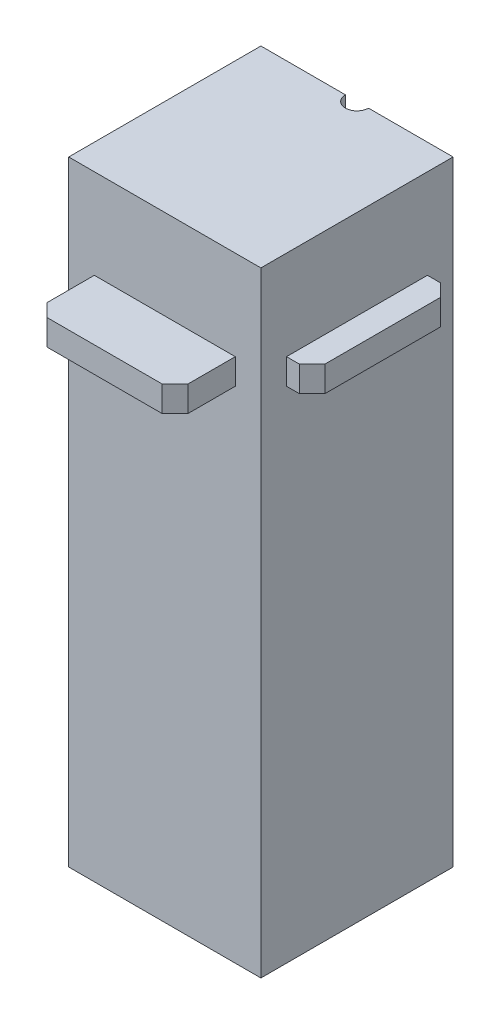
from build123d import *

# Parameters (mm, degrees)
SKETCH2_W            = 150
SKETCH2_H            = 150
SKETCH2_W_2          = 130
SKETCH2_H_2          = 130
BOSS_EXTRUDE2_DEPTH  = 450
SKETCH4_W            = 150
SKETCH4_H            = 150
BOSS_EXTRUDE3_DEPTH  = 15
BOSS_EXTRUDE4_START  = -450
SKETCH4_2_W          = 150
SKETCH4_2_H          = 150
BOSS_EXTRUDE4_DEPTH  = 15
SKETCH5_R            = 30
CUT_EXTRUDE1_DEPTH   = 15
SKETCH7_W            = 20
SKETCH7_H            = 10
BOSS_EXTRUDE5_DEPTH  = 50
BOSS_EXTRUDE6_START  = -10
SKETCH9_R            = 25
BOSS_EXTRUDE6_DEPTH  = 20
CUT_EXTRUDE3_START   = 5
SKETCH10_R           = 25
SKETCH10_R_2         = 22
CUT_EXTRUDE3_DEPTH   = 10
SKETCH12_W           = 20
SKETCH12_H           = 40
BOSS_EXTRUDE7_DEPTH  = 25
SKETCH13_R           = 4
BOSS_EXTRUDE8_DEPTH  = 23
SKETCH14_R           = 9
CUT_EXTRUDE5_DEPTH   = 500
BOSS_EXTRUDE10_START = -150
BOSS_EXTRUDE10_DEPTH = 200
SKETCH18_W           = 110
SKETCH18_H           = 20
BOSS_EXTRUDE11_DEPTH = 20
CHAMFER1_SIZE        = 10
CHAMFER2_SIZE        = 10
SKETCH19_W           = 110
SKETCH19_H           = 20
BOSS_EXTRUDE12_DEPTH = 47
CHAMFER3_SIZE        = 10


with BuildPart() as part:
    # Sketch2 → Boss-Extrude2 (new body)
    with BuildSketch(Plane(origin=(0, 0, 0), x_dir=(1, 0, 0), z_dir=(0, 1, 0))):
        Rectangle(SKETCH2_W, SKETCH2_H)
        Rectangle(SKETCH2_W_2, SKETCH2_H_2, mode=Mode.SUBTRACT)
    extrude(amount=BOSS_EXTRUDE2_DEPTH)

    # Sketch4 → Boss-Extrude3 (add)
    with BuildSketch(Plane(origin=(0, 450, 0), x_dir=(1, 0, 0), z_dir=(0, 1, 0))):
        Rectangle(SKETCH4_W, SKETCH4_H)
    extrude(amount=BOSS_EXTRUDE3_DEPTH)

    # Sketch4<2> → Boss-Extrude4 (add)
    with BuildSketch(Plane(origin=(0, 450, 0), x_dir=(1, 0, 0), z_dir=(0, 1, 0)).offset(BOSS_EXTRUDE4_START)):
        Rectangle(SKETCH4_2_W, SKETCH4_2_H)
    extrude(amount=-BOSS_EXTRUDE4_DEPTH)

    # Sketch5 → Cut-Extrude1 (cut)
    with BuildSketch(Plane.XZ.offset(15)):
        with Locations((-35, 0)):
            Circle(SKETCH5_R)
    extrude(amount=-CUT_EXTRUDE1_DEPTH, mode=Mode.SUBTRACT)

    # Sketch7 → Boss-Extrude5 (add)
    with BuildSketch(Plane.XZ.offset(-450)):
        with Locations((0, -15)):
            Rectangle(SKETCH7_W, SKETCH7_H)
    boss_extrude5 = extrude(amount=BOSS_EXTRUDE5_DEPTH)

    # Mirror1: Boss-Extrude5 across plane
    add(boss_extrude5.mirror(Plane.XY))

    # Sketch9 → Boss-Extrude6 (add)
    with BuildSketch(Plane.XY.offset(BOSS_EXTRUDE6_START)):
        with Locations((0, 420)):
            Circle(SKETCH9_R)
    extrude(amount=BOSS_EXTRUDE6_DEPTH)

    # Sketch10 → Cut-Extrude3 (cut)
    with BuildSketch(Plane.XY.offset(-10).offset(CUT_EXTRUDE3_START)):
        with Locations((0, 420)):
            Circle(SKETCH10_R)
        with Locations((0, 420)):
            Circle(SKETCH10_R_2, mode=Mode.SUBTRACT)
    extrude(amount=CUT_EXTRUDE3_DEPTH, mode=Mode.SUBTRACT)

    # Sketch12 → Boss-Extrude7 (add)
    with BuildSketch(Plane(origin=(0, 0, 0), x_dir=(1, 0, 0), z_dir=(0, 1, 0))):
        with Locations((35, 43)):
            Rectangle(SKETCH12_W, SKETCH12_H)
    extrude(amount=BOSS_EXTRUDE7_DEPTH)

    # Sketch13 → Boss-Extrude8 (add)
    with BuildSketch(Plane.XY.offset(-23)):
        with Locations((35.121485498, 12.610702381)):
            Circle(SKETCH13_R)
    extrude(amount=BOSS_EXTRUDE8_DEPTH)

    # Sketch14 → Cut-Extrude5 (cut)
    with BuildSketch(Plane(origin=(0, 465, 0), x_dir=(1, 0, 0), z_dir=(0, 1, 0))):
        with Locations((0, 75)):
            Circle(SKETCH14_R)
    extrude(amount=-CUT_EXTRUDE5_DEPTH, mode=Mode.SUBTRACT)

    # Sketch17 → Boss-Extrude10 (add)
    with BuildSketch(Plane(origin=(0, 465, 0), x_dir=(1, 0, 0), z_dir=(0, 1, 0)).offset(BOSS_EXTRUDE10_START)):
        with BuildLine():
            Line((-9, 75), (-13, 75))
            ThreePointArc((-13, 75), (0, 88), (13, 75))
            Line((13, 75), (9, 75))
            ThreePointArc((9, 75), (0, 84), (-9, 75))
        make_face()
    extrude(amount=-BOSS_EXTRUDE10_DEPTH)

    # Sketch18 → Boss-Extrude11 (add)
    with BuildSketch(Plane(origin=(75, 0, 0), x_dir=(0, 0, -1), z_dir=(1, 0, 0))):
        with Locations((0, 385)):
            Rectangle(SKETCH18_W, SKETCH18_H)
    extrude(amount=BOSS_EXTRUDE11_DEPTH)

    # Chamfer1
    chamfer1_edges = [part.edges().sort_by_distance(p)[0] for p in [
        (95, 385, 55),
    ]]
    chamfer(chamfer1_edges, length=CHAMFER1_SIZE)

    # Chamfer2
    chamfer2_edges = [part.edges().sort_by_distance(p)[0] for p in [
        (95, 385, -55),
    ]]
    chamfer(chamfer2_edges, length=CHAMFER2_SIZE)

    # Sketch19 → Boss-Extrude12 (add)
    with BuildSketch(Plane.XY.offset(75)):
        with Locations((0, 385)):
            Rectangle(SKETCH19_W, SKETCH19_H)
    extrude(amount=BOSS_EXTRUDE12_DEPTH)

    # Chamfer3
    chamfer3_edges = [part.edges().sort_by_distance(p)[0] for p in [
        (-55, 385, 122),
        (55, 385, 122),
    ]]
    chamfer(chamfer3_edges, length=CHAMFER3_SIZE)


solid = part.part
